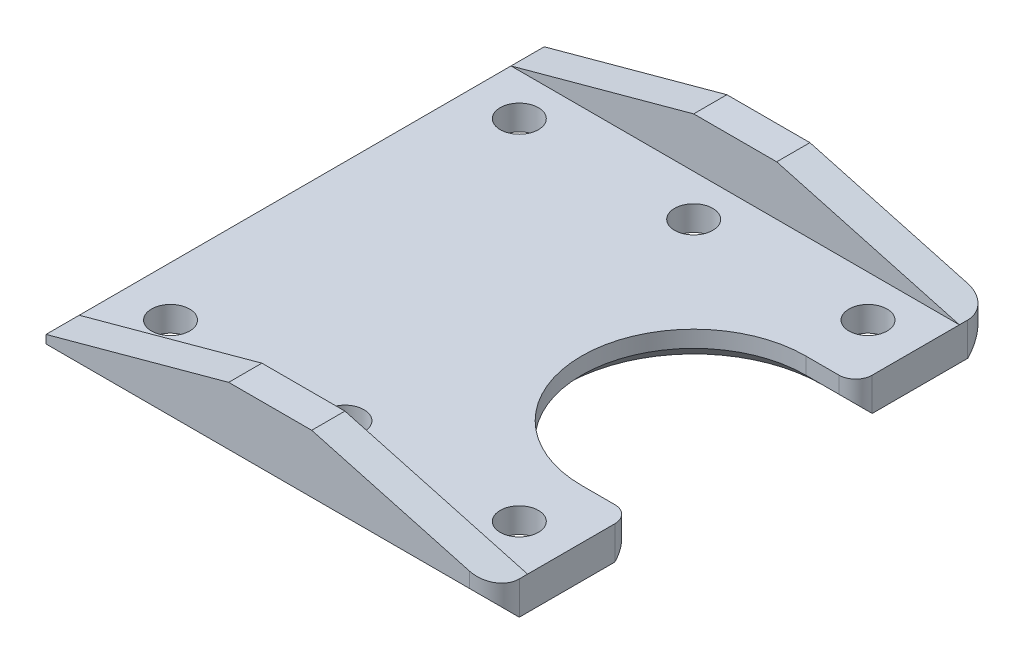
from build123d import *

# Parameters (mm, degrees)
EXTRUDE_1_DEPTH              = 27
CUT_EXTRUDE_1_REACH          = 33.032
HOLE_WIZARD_M2_1_D           = 2.3
HOLE_WIZARD_M2_1_CBORE_D     = 3.8
HOLE_WIZARD_M2_1_CBORE_DEPTH = 0.5
PATTERN_LINEAR_1_COUNT       = 3
PATTERN_LINEAR_1_PITCH       = 10.5
MIRROR_1_COPY_1_D            = 2.3
MIRROR_1_COPY_1_CBORE_D      = 3.8
MIRROR_1_COPY_1_CBORE_DEPTH  = 0.5
MIRROR_1_COPY_2_D            = 2.3
MIRROR_1_COPY_2_CBORE_D      = 3.8
MIRROR_1_COPY_2_CBORE_DEPTH  = 0.5
CHAMFER_1_SIZE               = 1
MIRROR_3_COPY_1_D            = 2.3
MIRROR_3_COPY_1_CBORE_D      = 3.8
MIRROR_3_COPY_1_CBORE_DEPTH  = 0.5
MIRROR_3_COPY_2_D            = 2.3
MIRROR_3_COPY_2_CBORE_D      = 3.8
MIRROR_3_COPY_2_CBORE_DEPTH  = 0.5
MIRROR_3_COPY_3_D            = 2.3
MIRROR_3_COPY_3_CBORE_D      = 3.8
MIRROR_3_COPY_3_CBORE_DEPTH  = 0.5
MIRROR_3_COPY_4_D            = 2.3
MIRROR_3_COPY_4_CBORE_D      = 3.8
MIRROR_3_COPY_4_CBORE_DEPTH  = 0.5
MIRROR_3_COPY_5_D            = 2.3
MIRROR_3_COPY_5_CBORE_D      = 3.8
MIRROR_3_COPY_5_CBORE_DEPTH  = 0.5
CHAMFER_1_OF_MIRROR_3_SIZE   = 1
FILLET_1_R                   = 1.5
FILLET_2_R                   = 1
CHAMFER_2_SIZE               = 1.5
CUT_EXTRUDE_2_DEPTH          = 41.669398815


with BuildPart() as part:
    # ｽｹｯﾁ1 → ﾎﾞｽ - 押し出し1 (new, symmetric)
    with BuildSketch(Plane(origin=(0, 0, 0), x_dir=(0, 0, -1), z_dir=(1, 0, 0))):
        Polygon((-15, 0), (15, 0), (15, 5), (13, 5), (13, 2), (-13, 2), (-13, 5), (-15, 5), align=None)
    extrude(amount=EXTRUDE_1_DEPTH, both=True)

    # ｽｹｯﾁ2 → ｶｯﾄ - 押し出し1 (cut, up to next)
    with BuildSketch(Plane(origin=(0, 2, 0), x_dir=(1, 0, 0), z_dir=(0, 1, 0)), mode=Mode.PRIVATE) as cut_extrude_1_sk1:
        with BuildLine():
            Line((24, 6.75), (28, 6.75))
            Line((28, 6.75), (28, -6.75))
            Line((28, -6.75), (24, -6.75))
            ThreePointArc((24, -6.75), (17.25, 0), (24, 6.75))
        make_face()
    cut_extrude_1_tool1 = extrude(cut_extrude_1_sk1.sketch, amount=-CUT_EXTRUDE_1_REACH, mode=Mode.PRIVATE) & part.part
    cut_extrude_1 = cut_extrude_1_tool1.solids().sort_by_distance((23.22727, 2, 0))[0]
    add(cut_extrude_1, mode=Mode.SUBTRACT)

    # M2 丸平ねじ用座ぐり穴1 (through all)
    with Locations(Plane(origin=(0, 0, 0), x_dir=(-1, 0, 0), z_dir=(0, -1, 0))):
        with Locations((-24, -10.5)):
            hole_wizard_m2_1 = CounterBoreHole(HOLE_WIZARD_M2_1_D / 2, HOLE_WIZARD_M2_1_CBORE_D / 2, HOLE_WIZARD_M2_1_CBORE_DEPTH)

    # 直線ﾊﾟﾀｰﾝ1: M2 丸平ねじ用座ぐり穴1 ×3
    with Locations(*[(-i * PATTERN_LINEAR_1_PITCH, 0, 0) for i in range(1, PATTERN_LINEAR_1_COUNT)]):
        add(hole_wizard_m2_1, mode=Mode.SUBTRACT)

    # ﾐﾗｰ1: M2 丸平ねじ用座ぐり穴1 across plane
    add(hole_wizard_m2_1.mirror(Plane.XY), mode=Mode.SUBTRACT)

    # ﾐﾗｰ1 copy 1 (through all)
    with Locations(Plane(origin=(-10.5, 0, 0), x_dir=(-1, 0, 0), z_dir=(0, -1, 0))):
        with Locations((-24, 10.5)):
            CounterBoreHole(MIRROR_1_COPY_1_D / 2, MIRROR_1_COPY_1_CBORE_D / 2, MIRROR_1_COPY_1_CBORE_DEPTH)

    # ﾐﾗｰ1 copy 2 (through all)
    with Locations(Plane(origin=(-21, 0, 0), x_dir=(-1, 0, 0), z_dir=(0, -1, 0))):
        with Locations((-24, 10.5)):
            CounterBoreHole(MIRROR_1_COPY_2_D / 2, MIRROR_1_COPY_2_CBORE_D / 2, MIRROR_1_COPY_2_CBORE_DEPTH)

    # 面取り1
    chamfer_1_edges = [part.edges().sort_by_distance(p)[0] for p in [
        (25.5, 0, 6.75),
        (17.25, 0, 0),
        (25.5, 0, -6.75),
    ]]
    chamfer(chamfer_1_edges, length=CHAMFER_1_SIZE)

    # ﾐﾗｰ3: ｶｯﾄ - 押し出し1, M2 丸平ねじ用座ぐり穴1 across plane
    add(cut_extrude_1.mirror(Plane(origin=(0, 0, 0), x_dir=(0, 0, 1), z_dir=(1, 0, 0))), mode=Mode.SUBTRACT)
    add(hole_wizard_m2_1.mirror(Plane(origin=(0, 0, 0), x_dir=(0, 0, 1), z_dir=(1, 0, 0))), mode=Mode.SUBTRACT)

    # ﾐﾗｰ3 copy 1 (through all)
    with Locations(Plane(origin=(10.5, 0, 0), x_dir=(1, 0, 0), z_dir=(0, -1, 0))):
        with Locations((-24, 10.5)):
            CounterBoreHole(MIRROR_3_COPY_1_D / 2, MIRROR_3_COPY_1_CBORE_D / 2, MIRROR_3_COPY_1_CBORE_DEPTH)

    # ﾐﾗｰ3 copy 2 (through all)
    with Locations(Plane(origin=(21, 0, 0), x_dir=(1, 0, 0), z_dir=(0, -1, 0))):
        with Locations((-24, 10.5)):
            CounterBoreHole(MIRROR_3_COPY_2_D / 2, MIRROR_3_COPY_2_CBORE_D / 2, MIRROR_3_COPY_2_CBORE_DEPTH)

    # ﾐﾗｰ3 copy 3 (through all)
    with Locations(Plane.XZ):
        with Locations((-24, -10.5)):
            CounterBoreHole(MIRROR_3_COPY_3_D / 2, MIRROR_3_COPY_3_CBORE_D / 2, MIRROR_3_COPY_3_CBORE_DEPTH)

    # ﾐﾗｰ3 copy 4 (through all)
    with Locations(Plane(origin=(10.5, 0, 0), x_dir=(1, 0, 0), z_dir=(0, -1, 0))):
        with Locations((-24, -10.5)):
            CounterBoreHole(MIRROR_3_COPY_4_D / 2, MIRROR_3_COPY_4_CBORE_D / 2, MIRROR_3_COPY_4_CBORE_DEPTH)

    # ﾐﾗｰ3 copy 5 (through all)
    with Locations(Plane(origin=(21, 0, 0), x_dir=(1, 0, 0), z_dir=(0, -1, 0))):
        with Locations((-24, -10.5)):
            CounterBoreHole(MIRROR_3_COPY_5_D / 2, MIRROR_3_COPY_5_CBORE_D / 2, MIRROR_3_COPY_5_CBORE_DEPTH)

    # 面取り1 of ﾐﾗｰ3
    chamfer_1_of_mirror_3_edges = [part.edges().sort_by_distance(p)[0] for p in [
        (-25.5, 0, 6.75),
        (-17.25, 0, 0),
        (-25.5, 0, -6.75),
    ]]
    chamfer(chamfer_1_of_mirror_3_edges, length=CHAMFER_1_OF_MIRROR_3_SIZE)

    # ﾌｨﾚｯﾄ1
    fillet_1_edges = [part.edges().sort_by_distance(p)[0] for p in [
        (27, 2.5, -15),
        (-27, 2.5, 15),
        (27, 2.5, 15),
        (-27, 2.5, -15),
    ]]
    fillet(fillet_1_edges, radius=FILLET_1_R)

    # ﾌｨﾚｯﾄ2
    fillet_2_edges = [part.edges().sort_by_distance(p)[0] for p in [
        (27, 1.5, -6.75),
        (27, 1.5, 6.75),
        (-27, 1.5, -6.75),
        (-27, 1.5, 6.75),
    ]]
    fillet(fillet_2_edges, radius=FILLET_2_R)

    # 面取り2
    # the kernel refuses this chamfer: 1.5 mm, written as the material it takes off along each edge
    with BuildSketch(Plane(origin=(-29.357524482, 0, -15), x_dir=(0, -0.02749587661058654, 0.9996219169112965), z_dir=(1, 0, 0)), Plane(origin=(29.357524482, 0, 15), x_dir=(0, -0.027495876610586178, -0.9996219169112968), z_dir=(-1, 0, 0))) as chamfer_2_piece_1:
        Polygon((CHAMFER_2_SIZE * 0.999621916911, -CHAMFER_2_SIZE * 0.0274958766106), (-CHAMFER_2_SIZE * 0.0274958766106, -CHAMFER_2_SIZE * 0.999621916911), (0, 0), align=None)
    extrude(amount=58.715048964, mode=Mode.SUBTRACT)

    # ｽｹｯﾁ6 → ｶｯﾄ - 押し出し2 (cut, through all)
    with BuildSketch(Plane.XY.offset(15)):
        Polygon((27, 5), (16, 5), (27, 2), align=None)
        Polygon((11, 5), (-27, 5), (-27, 0), (0, 0), (0, 2), align=None)
    extrude(amount=-CUT_EXTRUDE_2_DEPTH, mode=Mode.SUBTRACT)


solid = part.part
